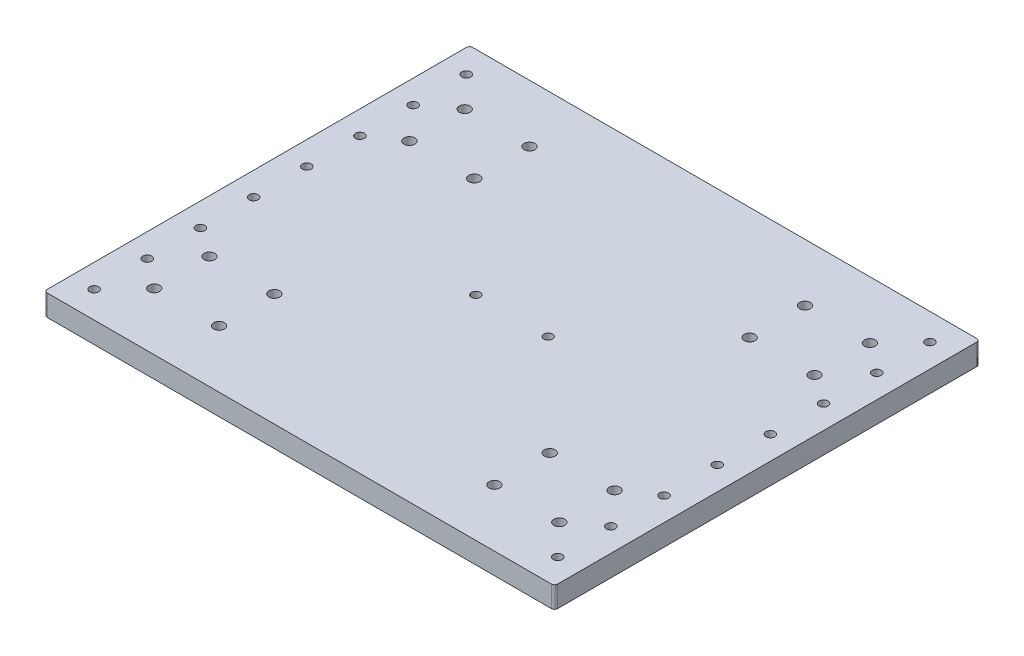
from build123d import *

# Parameters (mm, degrees)
SKETCH1_W           = 240
SKETCH1_H           = 200
BOSS_EXTRUDE1_DEPTH = 5
SKETCH2_R           = 2.55
CUT_EXTRUDE1_DEPTH  = 157.524758425
SKETCH3_R           = 2.05
CUT_EXTRUDE2_DEPTH  = 157.524758425
SKETCH4_R           = 2.1
CUT_EXTRUDE3_DEPTH  = 157.524758425
FILLET1_R           = 1.5
LPATTERN2_COUNT     = 8
LPATTERN2_PITCH     = 25


with BuildPart() as part:
    # Sketch1 → Boss-Extrude1 (new, symmetric)
    with BuildSketch(Plane(origin=(0, 0, 0), x_dir=(1, 0, 0), z_dir=(0, 1, 0))):
        Rectangle(SKETCH1_W, SKETCH1_H)
    extrude(amount=BOSS_EXTRUDE1_DEPTH, both=True)

    # Sketch2 → Cut-Extrude1 (cut, through all)
    with BuildSketch(Plane(origin=(0, 5, 0), x_dir=(1, 0, 0), z_dir=(0, 1, 0))):
        with Locations((-95.25, 73)):
            Circle(SKETCH2_R)
        with Locations((-95.25, 47)):
            Circle(SKETCH2_R)
        with Locations((-64.75, 73)):
            Circle(SKETCH2_R)
        with Locations((-64.75, 47)):
            Circle(SKETCH2_R)
        with Locations((-95.25, -47)):
            Circle(SKETCH2_R)
        with Locations((-95.25, -73)):
            Circle(SKETCH2_R)
        with Locations((-64.75, -73)):
            Circle(SKETCH2_R)
        with Locations((-64.75, -47)):
            Circle(SKETCH2_R)
        with Locations((95.25, -47)):
            Circle(SKETCH2_R)
        with Locations((64.75, -47)):
            Circle(SKETCH2_R)
        with Locations((64.75, -73)):
            Circle(SKETCH2_R)
        with Locations((95.25, -73)):
            Circle(SKETCH2_R)
        with Locations((64.75, 73)):
            Circle(SKETCH2_R)
        with Locations((64.75, 47)):
            Circle(SKETCH2_R)
        with Locations((95.25, 73)):
            Circle(SKETCH2_R)
        with Locations((95.25, 47)):
            Circle(SKETCH2_R)
    extrude(amount=-CUT_EXTRUDE1_DEPTH, mode=Mode.SUBTRACT)

    # Sketch3 → Cut-Extrude2 (cut, through all)
    with BuildSketch(Plane(origin=(0, 5, 0), x_dir=(1, 0, 0), z_dir=(0, 1, 0))):
        with Locations((-17, 0)):
            Circle(SKETCH3_R)
        with Locations((17, 0)):
            Circle(SKETCH3_R)
    extrude(amount=-CUT_EXTRUDE2_DEPTH, mode=Mode.SUBTRACT)

    # Sketch4 → Cut-Extrude3 (cut, through all)
    with BuildSketch(Plane(origin=(0, 5, 0), x_dir=(1, 0, 0), z_dir=(0, 1, 0))):
        with Locations((-109, 87.5)):
            Circle(SKETCH4_R)
        with Locations((109, 87.5)):
            Circle(SKETCH4_R)
    cut_extrude3 = extrude(amount=-CUT_EXTRUDE3_DEPTH, mode=Mode.SUBTRACT)

    # Fillet1
    fillet1_edges = [part.edges().sort_by_distance(p)[0] for p in [
        (-120, 0, -100),
        (120, 0, -100),
        (-120, 0, 100),
        (120, 0, 100),
    ]]
    fillet(fillet1_edges, radius=FILLET1_R)

    # LPattern2: Cut-Extrude3 ×8
    with Locations(*[(0, 0, i * LPATTERN2_PITCH) for i in range(1, LPATTERN2_COUNT)]):
        add(cut_extrude3, mode=Mode.SUBTRACT)


solid = part.part
